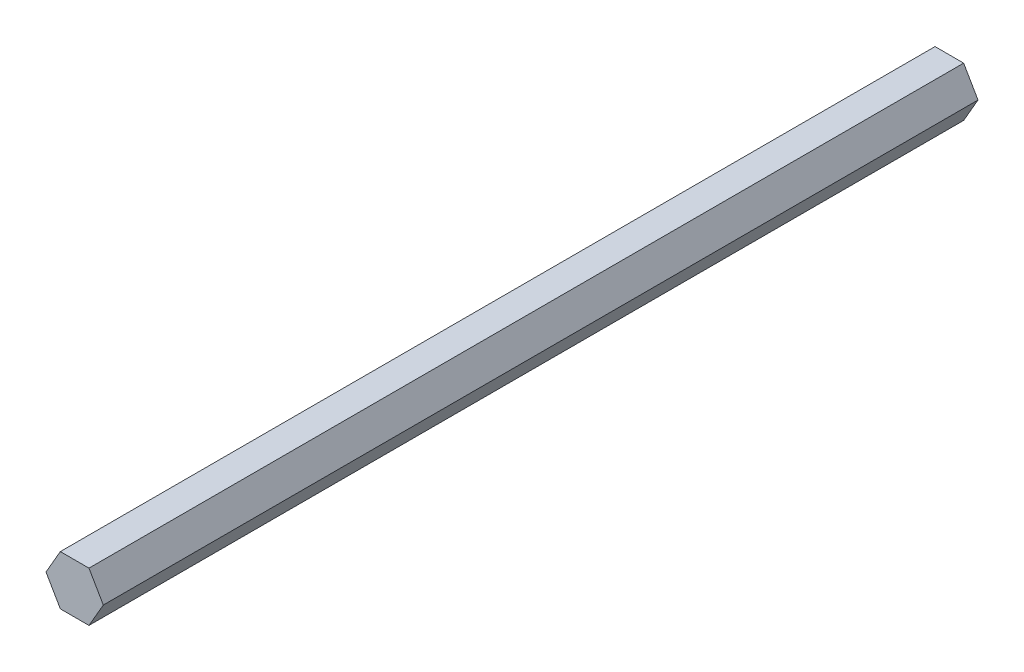
from build123d import *

# Parameters (mm, degrees)
BOSS_EXTRUDE1_DEPTH = 223.8375


with BuildPart() as part:
    # Sketch1 → Boss-Extrude1 (new body)
    with BuildSketch(Plane.XY):
        Polygon((-7.332348419, 0), (-3.666174209, -6.35), (3.666174209, -6.35), (7.332348419, 0), (3.666174209, 6.35), (-3.666174209, 6.35), align=None)
    extrude(amount=BOSS_EXTRUDE1_DEPTH)


solid = part.part
